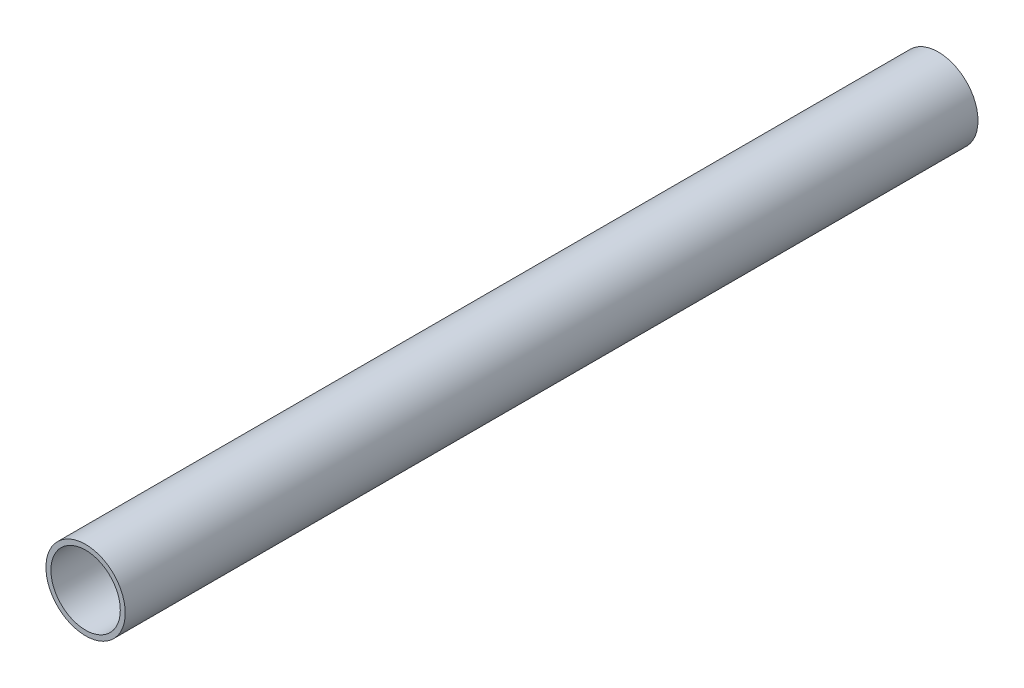
from build123d import *

# Parameters (mm, degrees)
SKETCH1_R           = 25.4
SKETCH1_R_2         = 22.225
BOSS_EXTRUDE1_DEPTH = 273.05


with BuildPart() as part:
    # Sketch1 → Boss-Extrude1 (new, symmetric)
    with BuildSketch(Plane.XY):
        Circle(SKETCH1_R)
        Circle(SKETCH1_R_2, mode=Mode.SUBTRACT)
    extrude(amount=BOSS_EXTRUDE1_DEPTH, both=True)


solid = part.part
